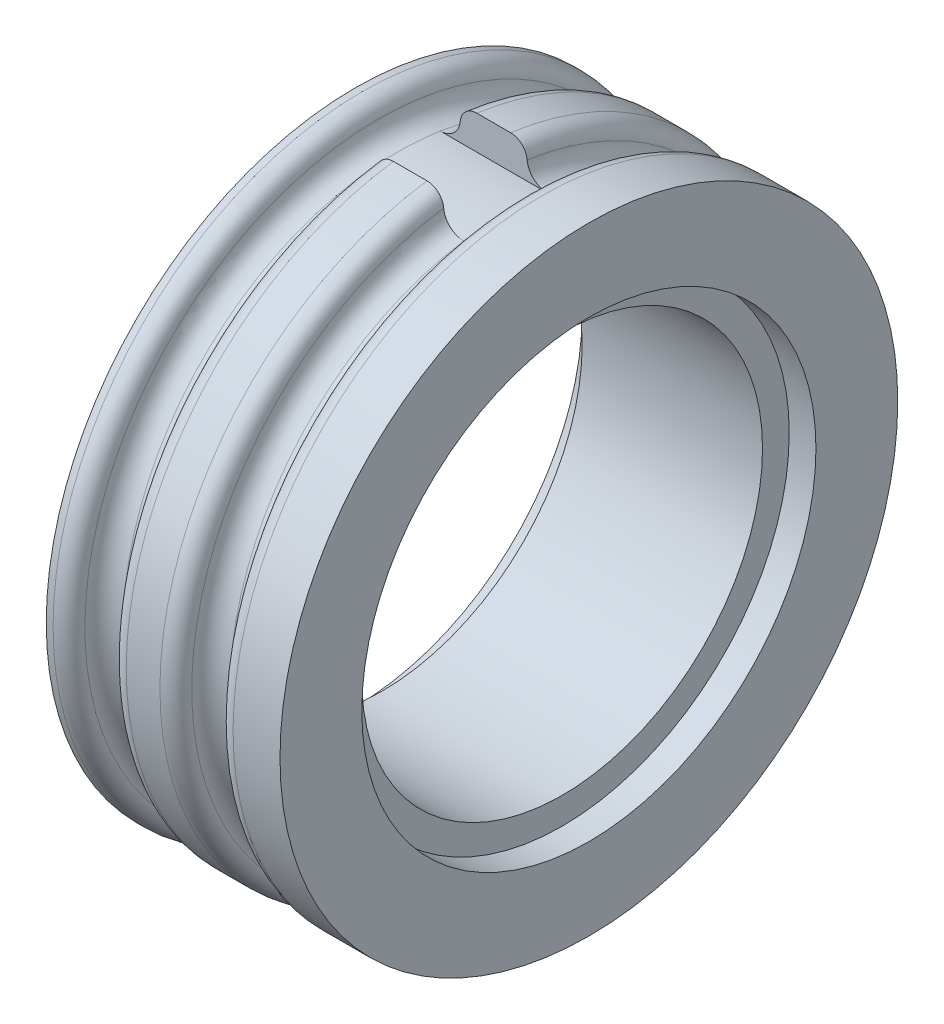
from build123d import *

# Parameters (mm, degrees)
CUT_EXTRUDE3_REACH      = 24.475
CUT_EXTRUDE3_END_RADIUS = 8.25
SKETCH7_W               = 2
SKETCH7_H               = 2.5
FILLET1_R               = 0.6
SKETCH3_R               = 6.8
CUT_EXTRUDE1_DEPTH      = 0.8
CUT_EXTRUDE2_START      = -0.8
SKETCH4_R               = 6.8
CUT_EXTRUDE2_DEPTH      = 0.8
FILLET2_R               = 0.5


with BuildPart() as part:
    # Sketch2 → Revolve1 (revolve)
    with BuildSketch(Plane(origin=(0, 0, 0), x_dir=(1, 0, 0), z_dir=(0, 1, 0))):
        Polygon((7, 9.25), (7, 6), (0, 6), (0, 9.25), (0.7, 9.25), (0.7, 8.25), (1.9, 8.25), (1.9, 9.25), (3.9, 9.25), (3.9, 8.25), (5.1, 8.25), (5.1, 9.25), align=None)
    revolve(axis=Axis((7, 0, 0), (-1, 0, 0)))

    # Cut-Extrude3: up to this cylinder (the profile starts outside it)
    cut_extrude3_end = Plane(origin=(2.9, 0, 0), z_dir=(1, 0, 0)) * Cylinder(CUT_EXTRUDE3_END_RADIUS, 66.45, mode=Mode.PRIVATE)
    # Sketch7 → Cut-Extrude3 (cut, up to the surface)
    with BuildSketch(Plane(origin=(0, 10, 0), x_dir=(1, 0, 0), z_dir=(0, 1, 0)), mode=Mode.PRIVATE) as cut_extrude3_sk1:
        with Locations((2.9, 0)):
            Rectangle(SKETCH7_W, SKETCH7_H)
    cut_extrude3_tool1 = extrude(cut_extrude3_sk1.sketch, amount=-CUT_EXTRUDE3_REACH, mode=Mode.PRIVATE) - cut_extrude3_end
    add(cut_extrude3_tool1.solids().sort_by_distance((2.9, 10, 0))[0], mode=Mode.SUBTRACT)

    # Fillet1
    fillet1_edges = [part.edges().sort_by_distance(p)[0] for p in [
        (0.7, 0, 8.25),
        (5.1, 0, 8.25),
        (1.9, -6.259992013, 5.373546315),
        (3.9, -6.259992013, 5.373546315),
    ]]
    fillet(fillet1_edges, radius=FILLET1_R - 0.0001)  # a hair under: the kernel refuses the full size

    # Sketch3 → Cut-Extrude1 (cut)
    with BuildSketch(Plane(origin=(7, 0, 0), x_dir=(0, 0, -1), z_dir=(1, 0, 0))):
        Circle(SKETCH3_R)
    extrude(amount=-CUT_EXTRUDE1_DEPTH, mode=Mode.SUBTRACT)

    # Sketch4 → Cut-Extrude2 (cut)
    with BuildSketch(Plane.ZY.offset(CUT_EXTRUDE2_START)):
        with Locations(Location((0, 0, 0), (0, 0, 180))):
            Circle(SKETCH4_R)
    extrude(amount=CUT_EXTRUDE2_DEPTH, mode=Mode.SUBTRACT)

    # Fillet2
    fillet2_edges = [part.edges().sort_by_distance(p)[0] for p in [
        (5.1, 0, 9.25),
        (3.9, -9.25, 0),
        (1.9, -9.25, 0),
        (0.7, 0, 9.25),
    ]]
    fillet(fillet2_edges, radius=FILLET2_R)


solid = part.part
